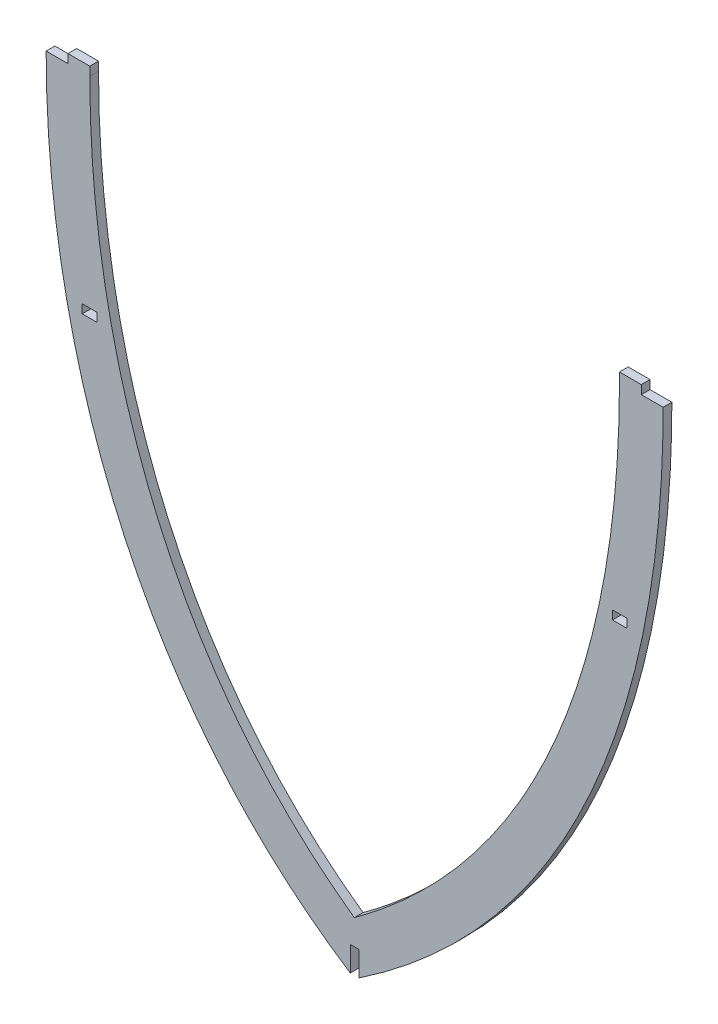
from build123d import *

# Parameters (mm, degrees)
SKETCH1_W           = 5
SKETCH1_H           = 3
BOSS_EXTRUDE1_DEPTH = 1.5
SKETCH2_W           = 3
SKETCH2_H           = 9.494035225
CUT_EXTRUDE1_DEPTH  = 3


with BuildPart() as part:
    # Sketch1 → Boss-Extrude1 (new, symmetric)
    with BuildSketch(Plane.XY):
        with BuildLine():
            Line((-106, -83), (-98.5, -83))
            Line((-98.5, -83), (-98.5, -80))
            Line((-98.5, -80), (-91, -80))
            Line((-91, -80), (-91, -83))
            add(Edge.make_bspline(
                [(-91, -83), (-91, -88.068550738), (-90.784224976, -98.220481237), (-89.47168793, -118.377767283), (-86.146815138, -143.230800288), (-79.368059247, -172.071120857), (-69.71738881, -199.531988744), (-57.11831244, -225.231718508), (-44.09611353, -244.888891231), (-32.112008882, -259.401886537), (-22.324804426, -269.642683196), (-13.481107719, -277.613388782), (-5.992695326, -283.625797901), (-2.089373231, -286.521065709), (-0.116739636, -287.926353347)],
                knots=[0, 0, 0, 0, 0.059983469, 0.119966937, 0.239933875, 0.359900812, 0.47986775, 0.599834687, 0.719801625, 0.779785093, 0.839768562, 0.899752031, 0.929743765, 0.9597355, 0.9597355, 0.9597355, 0.9597355], degree=3))
            add(Edge.make_bspline(
                [(-0.116739636, -287.926353347), (1.870810321, -286.480217138), (5.811438827, -283.506382084), (13.355962702, -277.384642576), (22.257609381, -269.345287034), (32.090104581, -259.121737951), (44.109675826, -244.741072781), (57.139620096, -225.411627313), (69.725154077, -200.204558319), (79.363006417, -173.160517049), (85.009288933, -149.261906753), (88.135960803, -129.439309105), (89.796426225, -114.252560891), (90.618872692, -101.350995082), (90.945843548, -90.910045133), (91, -85.632026579), (91, -83)],
                knots=[0, 0, 0, 0, 0.030008035, 0.060016069, 0.120032138, 0.180048207, 0.240064276, 0.360096414, 0.480128553, 0.600160691, 0.720192829, 0.780208898, 0.840224967, 0.900241036, 0.930249071, 0.960257105, 0.960257105, 0.960257105, 0.960257105], degree=3))
            Line((91, -83), (91, -80))
            Line((91, -80), (98.5, -80))
            Line((98.5, -80), (98.5, -83))
            Line((98.5, -83), (106, -83))
            add(Edge.make_bspline(
                [(106, -83), (106, -174.443319162), (74.762940933, -256.782973383), (0, -306.089272366)],
                knots=[0, 0, 0, 0, 1, 1, 1, 1], degree=3))
            add(Edge.make_bspline(
                [(-106, -83), (-106, -171.171703536), (-74.762940933, -258.439171974), (0, -306.089272366)],
                knots=[0, 0, 0, 0, 1, 1, 1, 1], degree=3))
        make_face()
        with Locations((-91.1, -153.5)):
            Rectangle(SKETCH1_W, SKETCH1_H, mode=Mode.SUBTRACT)
        with Locations((91.1, -153.5)):
            Rectangle(SKETCH1_W, SKETCH1_H, mode=Mode.SUBTRACT)
    extrude(amount=BOSS_EXTRUDE1_DEPTH, both=True)

    # Sketch2 → Cut-Extrude1 (cut)
    with BuildSketch(Plane.XY.offset(1.5)):
        with Locations((0, -301.342254754)):
            Rectangle(SKETCH2_W, SKETCH2_H)
    extrude(amount=-CUT_EXTRUDE1_DEPTH, mode=Mode.SUBTRACT)


solid = part.part
